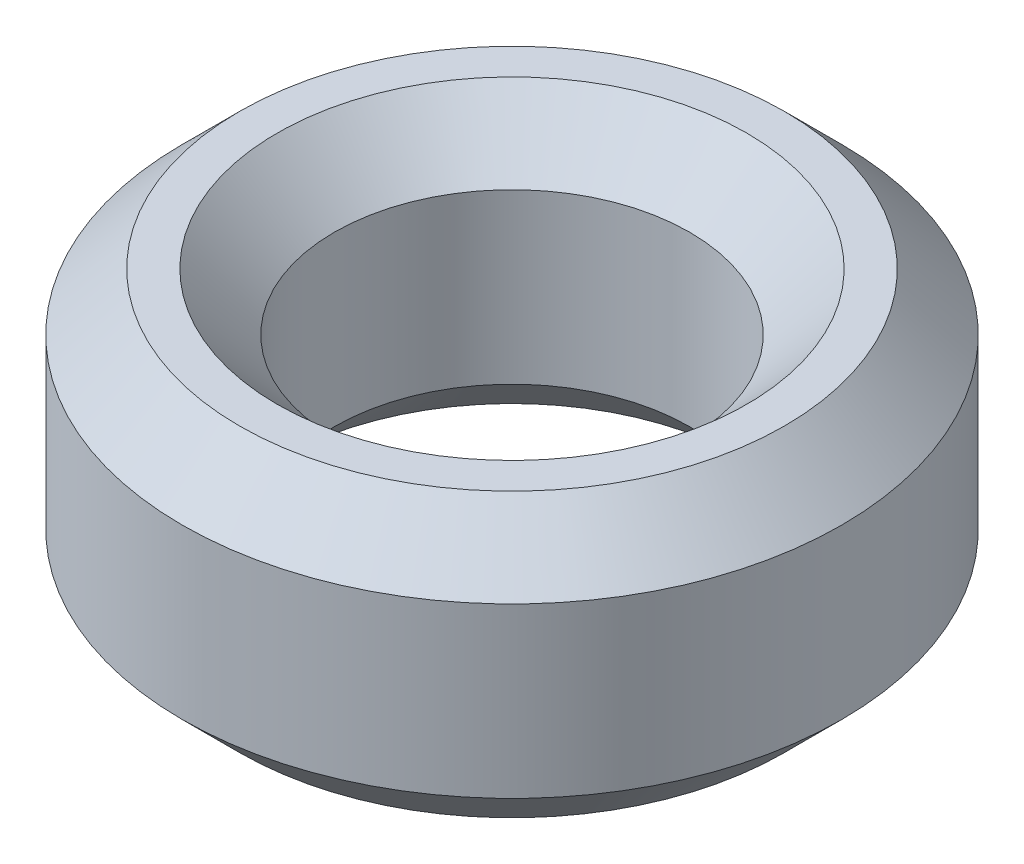
from build123d import *

# Parameters (mm, degrees)
SKETCH1_R           = 22.5
BOSS_EXTRUDE1_DEPTH = 19.30259704
SKETCH2_R           = 12.124395422
CUT_EXTRUDE1_DEPTH  = 38.216800675
CHAMFER1_SIZE       = 3.904772794


with BuildPart() as part:
    # Sketch1 → Boss-Extrude1 (new body)
    with BuildSketch(Plane(origin=(0, 0, 0), x_dir=(1, 0, 0), z_dir=(0, 1, 0))):
        Circle(SKETCH1_R)
    extrude(amount=BOSS_EXTRUDE1_DEPTH)

    # Sketch2 → Cut-Extrude1 (cut, through all)
    with BuildSketch(Plane(origin=(0, 0, 0), x_dir=(1, 0, 0), z_dir=(0, 1, 0))):
        Circle(SKETCH2_R)
    extrude(amount=CUT_EXTRUDE1_DEPTH, mode=Mode.SUBTRACT)

    # Chamfer1
    chamfer1_edges = [part.edges().sort_by_distance(p)[0] for p in [
        (-12.124395422, 19.30259704, 0),
        (-12.124395422, 0, 0),
        (-22.5, 0, 0),
        (-22.5, 19.30259704, 0),
    ]]
    chamfer(chamfer1_edges, length=CHAMFER1_SIZE)


solid = part.part
